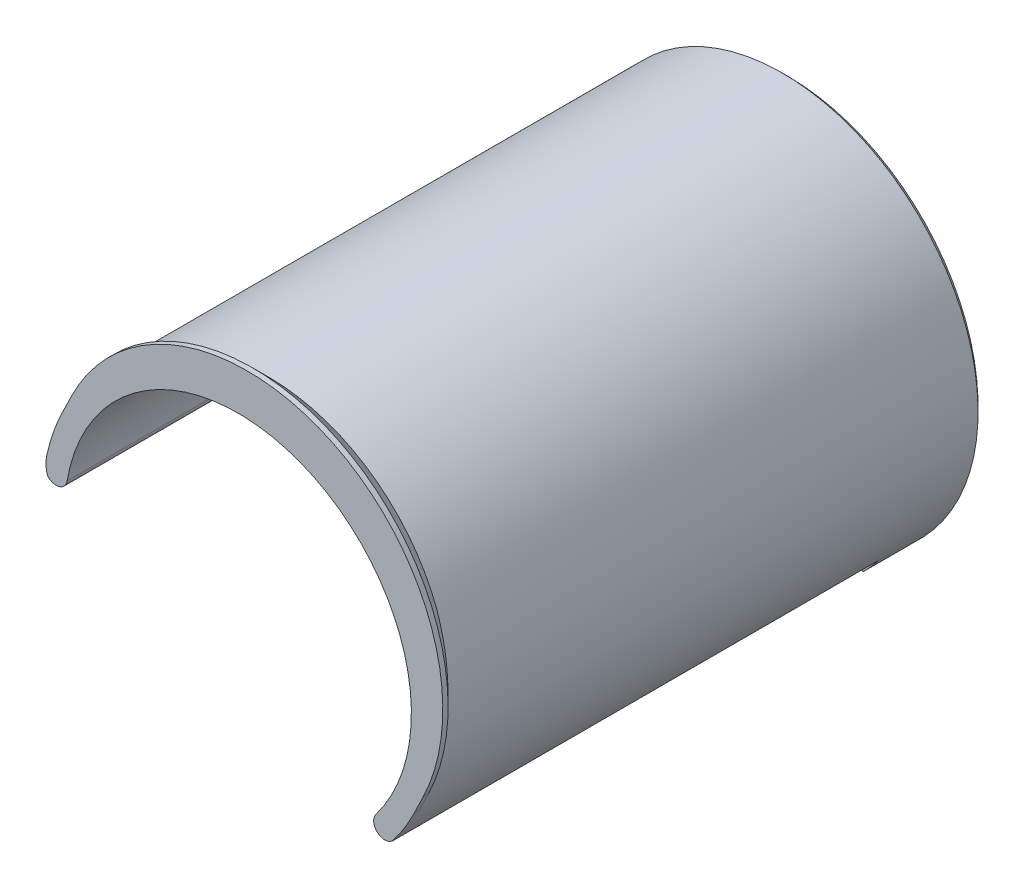
from build123d import *

# Parameters (mm, degrees)
SKETCH1_R           = 1.6
BOSS_EXTRUDE1_DEPTH = 52
CUT_EXTRUDE1_DEPTH  = 46
CUT_EXTRUDE2_DEPTH  = 3.6
CHAMFER1_SIZE       = 3
CHAMFER2_SIZE       = 0.5
BOSS_EXTRUDE2_DEPTH = 2
CHAMFER3_SIZE       = 1.5
CUT_EXTRUDE4_DEPTH  = 2.5


with BuildPart() as part:
    # Sketch1 → Boss-Extrude1 (new body)
    with BuildSketch(Plane.XY):
        with BuildLine():
            Line((-4.46161756, 0), (-3.2, 0))
            ThreePointArc((-3.2, 0), (-1.084064892, -3.010781179), (2.465502069, -2.039926359))
            Line((2.465502069, -2.039926359), (17.709814498, -14.652884646))
            ThreePointArc((17.709814498, -14.652884646), (19.682532968, -15.386676734), (21.68432718, -14.736377626))
            ThreePointArc((21.68432718, -14.736377626), (20.423085706, 15.613531633), (-7.590844762, 3.869281046))
            ThreePointArc((-7.590844762, 3.869281046), (-6.949759371, 1.187749934), (-4.46161756, 0))
        make_face()
        with Locations(Location((19.749740857, -12.187382577, 0), (0, 0, 180))):
            Circle(SKETCH1_R, mode=Mode.SUBTRACT)
        with Locations(Location((0, 0, 0), (0, 0, 180))):
            Circle(SKETCH1_R, mode=Mode.SUBTRACT)
    extrude(amount=BOSS_EXTRUDE1_DEPTH)

    # Sketch2 → Cut-Extrude1 (cut)
    with BuildSketch(Plane.XY.offset(52)):
        with BuildLine():
            Line((-7.75220957, 2.930270623), (-10.26732185, 3.33405514))
            ThreePointArc((-10.26732185, 3.33405514), (2.118916828, -19.291319949), (27.109557142, -12.904270303))
            Line((27.109557142, -12.904270303), (25.097988128, -11.341445354))
            ThreePointArc((25.097988128, -11.341445354), (23.677045606, -11.352651842), (23.546148123, -9.937706936))
            ThreePointArc((23.546148123, -9.937706936), (17.03488015, 15.04178651), (-5.667119596, 2.753950614))
            ThreePointArc((-5.667119596, 2.753950614), (-6.790684219, 1.884004769), (-7.75220957, 2.930270623))
        make_face()
    extrude(amount=-CUT_EXTRUDE1_DEPTH, mode=Mode.SUBTRACT)

    # Sketch3 → Cut-Extrude2 (cut)
    with BuildSketch(Plane.XY.offset(6)):
        with BuildLine():
            Line((1.692106757, 2.716021856), (20.436641856, -8.961997016))
            ThreePointArc((20.436641856, -8.961997016), (22.952539617, -9.338121402), (24.947839186, -7.760150957))
            ThreePointArc((24.947839186, -7.760150957), (18.297055064, 14.427956624), (-3.907979798, 7.833908229))
            ThreePointArc((-3.907979798, 7.833908229), (-3.696429412, 4.43953433), (-0.548333333, 3.152670385))
            ThreePointArc((-0.548333333, 3.152670385), (0.612143689, 3.140904345), (1.692106757, 2.716021856))
        make_face()
    extrude(amount=-CUT_EXTRUDE2_DEPTH, mode=Mode.SUBTRACT)

    # Chamfer1
    chamfer1_edges = [part.edges().sort_by_distance(p)[0] for p in [
        (0.612143689, 3.140904345, 2.4),
        (11.064374306, -3.12298758, 2.4),
        (22.952539617, -9.338121402, 2.4),
        (18.297055064, 14.427956624, 2.4),
        (-3.696429412, 4.43953433, 2.4),
    ]]
    chamfer(chamfer1_edges, length=CHAMFER1_SIZE)

    # Chamfer2
    chamfer2_edges = [part.edges().sort_by_distance(p)[0] for p in [
        (21.349740857, -12.187382577, 0),
        (1.6, 0, 0),
        (20.423085706, 15.613531633, 0),
        (19.682532968, -15.386676734, 0),
        (10.087658283, -8.346405502, 0),
        (-1.084064892, -3.010781179, 0),
        (-3.83080878, 0, 0),
        (-6.949759371, 1.187749934, 0),
    ]]
    chamfer(chamfer2_edges, length=CHAMFER2_SIZE)

    # Sketch4 → Boss-Extrude2 (add)
    with BuildSketch(Plane.XY.offset(52)):
        with BuildLine():
            Line((-6.147708238, 8.068693229), (-5.275417078, 9.868445471))
            ThreePointArc((-5.275417078, 9.868445471), (19.440984389, 18.44746048), (28.019999398, -6.268940987))
            Line((28.019999398, -6.268940987), (27.147708238, -8.068693229))
            Line((27.147708238, -8.068693229), (25.257968384, -7.152787511))
            ThreePointArc((25.257968384, -7.152787511), (17.652787511, 14.757968384), (-4.257968384, 7.152787511))
            Line((-4.257968384, 7.152787511), (-6.147708238, 8.068693229))
        make_face()
    extrude(amount=-BOSS_EXTRUDE2_DEPTH)

    # Chamfer3
    # the kernel refuses this chamfer: 1.5 mm, written as the material it takes off along each edge
    with BuildSketch(Plane(origin=(-7.83015049, 4.597399062, 50), x_dir=(0.8995358930200849, -0.43598068069350693, -0.02749587661058679), z_dir=(0.4361455799615031, 0.8998761209633491, 0))) as chamfer3_piece_1_section:
        Polygon((CHAMFER3_SIZE * 0.999621916911, -CHAMFER3_SIZE * 0.0274958766106), (-CHAMFER3_SIZE * 0.0274958766106, -CHAMFER3_SIZE * 0.999621916911), (0, 0), align=None)
    chamfer3_piece_1 = extrude(amount=5.857524482, mode=Mode.PRIVATE)
    chamfer3_piece_1 = chamfer3_piece_1 - Plane(origin=(10.5, 0, 50.729873863), x_dir=(0.6045582259252599, -0.7965609527626261, 0), z_dir=(0, 0, -1)) * Cylinder(18.5, 18, mode=Mode.PRIVATE)
    add(chamfer3_piece_1, mode=Mode.SUBTRACT)
    with BuildSketch(Plane(origin=(11.37229116, 1.799752242, 50), x_dir=(-0.899876120963349, 0.43614557996150355, 0), z_dir=(-0.43614557996150355, -0.899876120963349, 0))) as chamfer3_piece_2_section:
        Polygon((18.5, -CHAMFER3_SIZE), (18.5 - CHAMFER3_SIZE, 0), (18.5, 0), align=None)
    chamfer3_piece_2 = revolve(axis=Axis((11.37229116, 1.799752242, 50), (0, 0, -1)), revolution_arc=180, mode=Mode.PRIVATE)
    chamfer3_piece_2 = chamfer3_piece_2 - Plane(origin=(10.5, 0, 50.723063531), x_dir=(0.6045582259252599, -0.7965609527626261, 0), z_dir=(0, 0, -1)) * Cylinder(18.5, 75, mode=Mode.PRIVATE)
    add(chamfer3_piece_2, mode=Mode.SUBTRACT)
    with BuildSketch(Plane(origin=(28.019999398, -6.268940987, 50), x_dir=(0.024742882786820786, -0.011992205050873842, 0.9996219169112968), z_dir=(-0.43614557996150277, -0.8998761209633493, 0))) as chamfer3_piece_3_section:
        Polygon((CHAMFER3_SIZE * 0.999621916911, CHAMFER3_SIZE * 0.0274958766106), (-CHAMFER3_SIZE * 0.0274958766106, CHAMFER3_SIZE * 0.999621916911), (0, 0), align=None)
    chamfer3_piece_3 = extrude(amount=5.857524482, mode=Mode.PRIVATE)
    chamfer3_piece_3 = chamfer3_piece_3 - Plane(origin=(10.5, 0, 50.745956447), x_dir=(0.6045582259252599, -0.7965609527626261, 0), z_dir=(0, 0, -1)) * Cylinder(18.5, 18, mode=Mode.PRIVATE)
    add(chamfer3_piece_3, mode=Mode.SUBTRACT)

    # Sketch5 → Cut-Extrude4 (cut)
    with BuildSketch(Plane.XY.offset(6)):
        Polygon((3.348631561, 0), (1.674315781, 2.9), (-1.674315781, 2.9), (-5.480163243, -3.691921171), (0.106662744, -5.615254708), align=None)
        Polygon((18.075425076, -9.287382577), (13.043037161, -18.003734129), (26.456444552, -18.003734129), (21.424056637, -9.287382577), align=None)
    extrude(amount=-CUT_EXTRUDE4_DEPTH, mode=Mode.SUBTRACT)


solid = part.part
